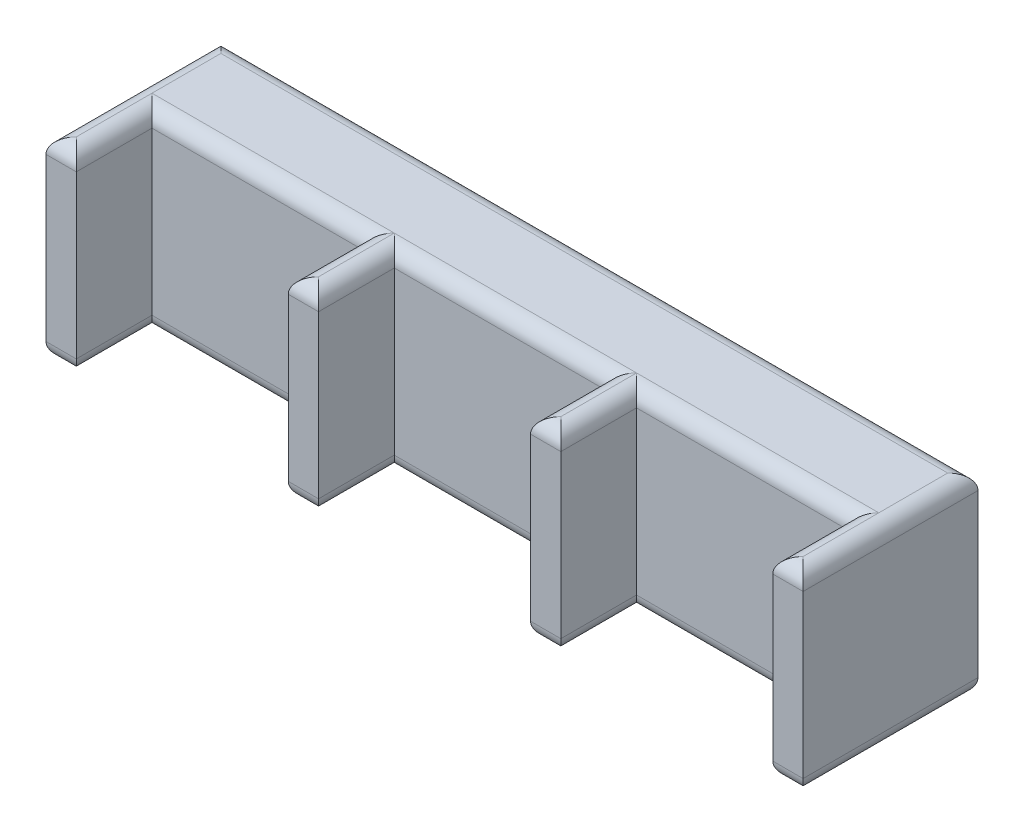
from build123d import *

# Parameters (mm, degrees)
SKETCH1_W           = 50
SKETCH1_H           = 12.7
BOSS_EXTRUDE1_DEPTH = 6.55
SKETCH2_W           = 48
SKETCH2_H           = 6.32
CUT_EXTRUDE2_DEPTH  = 6.35
SKETCH3_W           = 2
SKETCH3_H           = 12.7
BOSS_EXTRUDE2_DEPTH = 5
LPATTERN1_COUNT     = 4
LPATTERN1_PITCH     = 16
FILLET1_R           = 1


with BuildPart() as part:
    # Sketch1 → Boss-Extrude1 (new body)
    with BuildSketch(Plane.XY):
        Rectangle(SKETCH1_W, SKETCH1_H)
    extrude(amount=BOSS_EXTRUDE1_DEPTH)

    # Sketch2 → Cut-Extrude2 (cut)
    with BuildSketch(Plane(origin=(0, 0, 0), x_dir=(-1, 0, 0), z_dir=(0, 0, -1))):
        Rectangle(SKETCH2_W, SKETCH2_H)
    extrude(amount=-CUT_EXTRUDE2_DEPTH, mode=Mode.SUBTRACT)

    # Sketch3 → Boss-Extrude2 (add)
    with BuildSketch(Plane.XY.offset(6.55)):
        with Locations((-24, 0)):
            Rectangle(SKETCH3_W, SKETCH3_H)
    boss_extrude2 = extrude(amount=BOSS_EXTRUDE2_DEPTH)

    # LPattern1: Boss-Extrude2 ×4
    with Locations(*[(i * LPATTERN1_PITCH, 0, 0) for i in range(1, LPATTERN1_COUNT)]):
        add(boss_extrude2)

    # Fillet1
    fillet1_edges = [part.edges().sort_by_distance(p)[0] for p in [
        (-16, -6.35, 6.55),
        (-23, -6.35, 9.05),
        (-23, 6.35, 9.05),
        (-24, -6.35, 11.55),
        (-24, 6.35, 11.55),
        (0, -6.35, 6.55),
        (-16, 6.35, 6.55),
        (-9, 6.35, 9.05),
        (-9, -6.35, 9.05),
        (-7, -6.35, 9.05),
        (-7, 6.35, 9.05),
        (-8, -6.35, 11.55),
        (-8, 6.35, 11.55),
        (0, 6.35, 0),
        (0, 6.35, 6.55),
        (16, -6.35, 6.55),
        (7, 6.35, 9.05),
        (7, -6.35, 9.05),
        (9, -6.35, 9.05),
        (9, 6.35, 9.05),
        (8, -6.35, 11.55),
        (8, 6.35, 11.55),
        (0, -6.35, 0),
        (16, 6.35, 6.55),
        (23, 6.35, 9.05),
        (23, -6.35, 9.05),
        (24, -6.35, 11.55),
        (24, 6.35, 11.55),
        (-25, 6.35, 5.775),
        (25, 6.35, 5.775),
        (25, -6.35, 5.775),
        (-25, -6.35, 5.775),
    ]]
    fillet(fillet1_edges, radius=FILLET1_R - 0.0001)  # a hair under: the kernel refuses the full size


solid = part.part
